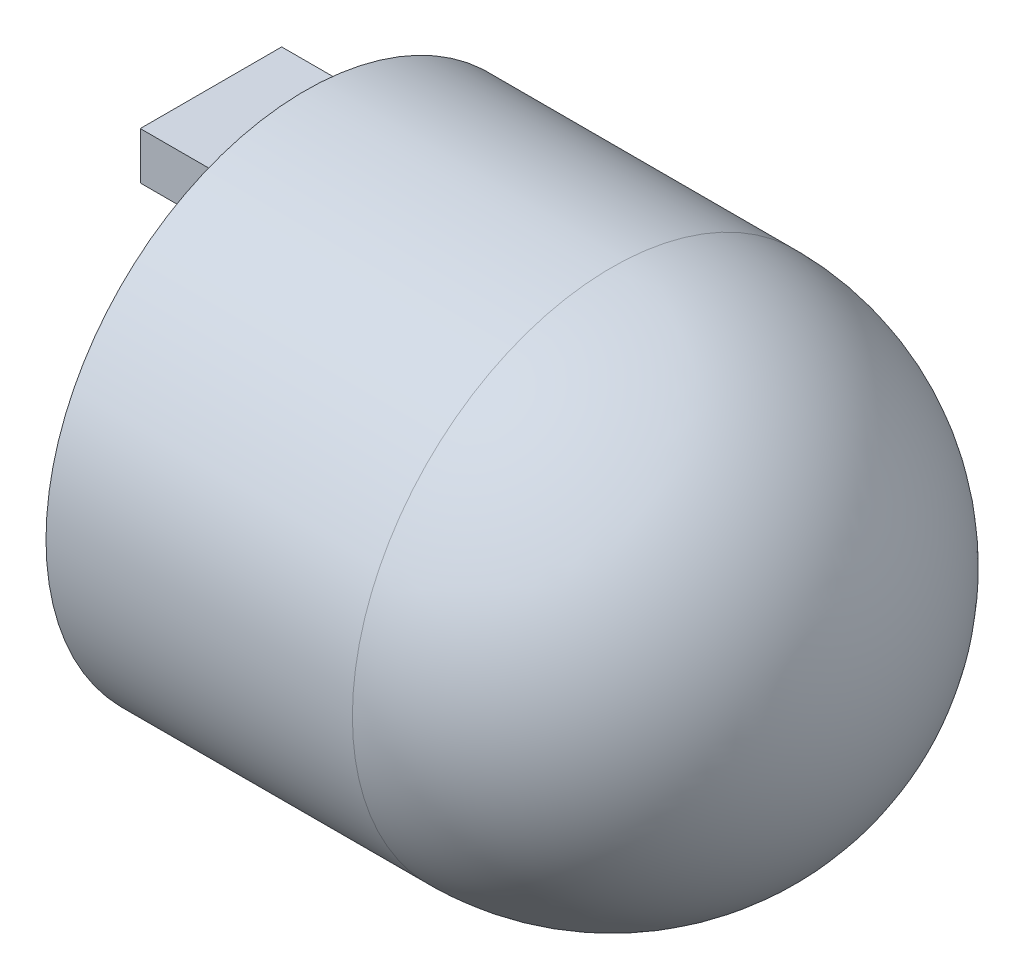
from build123d import *

# Parameters (mm, degrees)
CUT_EXTRUDE1_DEPTH  = 2.75
SKETCH5_W           = 3
SKETCH5_H           = 1
BOSS_EXTRUDE2_DEPTH = 2


with BuildPart() as part:
    # Sketch1 → Revolve1 (revolve)
    with BuildSketch(Plane.XY):
        with BuildLine():
            Line((0, 0), (12, 0))
            ThreePointArc((12, 0), (10.389087297, -3.889087297), (6.5, -5.5))
            Line((6.5, -5.5), (0, -5.5))
            Line((0, -5.5), (0, 0))
        make_face()
    revolve(axis=Axis((0, 0, 0), (1, 0, 0)))

    # Sketch2 → Cut-Extrude1 (cut)
    with BuildSketch(Plane.ZY):
        Polygon((2.050748156, 3.552), (-2.050748156, 3.552), (-4.101496312, 0), (-2.050748156, -3.552), (2.050748156, -3.552), (4.101496312, 0), align=None)
    extrude(amount=-CUT_EXTRUDE1_DEPTH, mode=Mode.SUBTRACT)

    # Sketch5 → Boss-Extrude2 (add)
    with BuildSketch(Plane.ZY):
        with Locations((0, 4.052)):
            Rectangle(SKETCH5_W, SKETCH5_H)
        with Locations((0, -4.052)):
            Rectangle(SKETCH5_W, SKETCH5_H)
    extrude(amount=BOSS_EXTRUDE2_DEPTH)


solid = part.part
